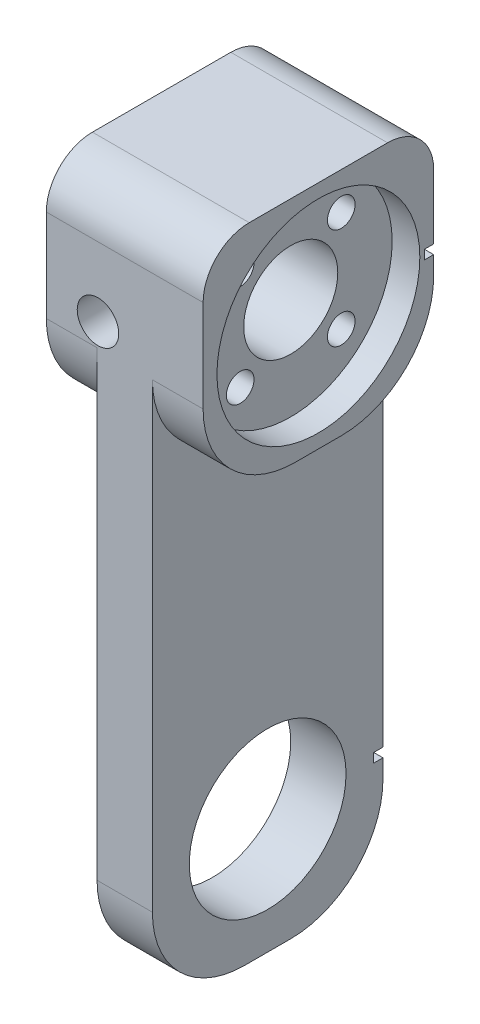
from build123d import *

# Parameters (mm, degrees)
CROQUIS1_W              = 25
CROQUIS1_H              = 25
SALIENTE_EXTRUIR1_DEPTH = 200
REDONDEO1_R             = 10
REDONDEO2_R             = 10
REDONDEO3_R             = 5
REDONDEO4_R             = 5
CROQUIS2_R              = 11
CROQUIS2_R_2            = 8.5
CORTAR_EXTRUIR1_DEPTH   = 6
CROQUIS3_R              = 8.5
CORTAR_EXTRUIR2_DEPTH   = 6
CROQUIS9_R              = 5.1
CROQUIS9_R_2            = 6
CORTAR_EXTRUIR6_DEPTH   = 30
CROQUIS13_W             = 1
CROQUIS13_H             = 5
CORTAR_EXTRUIR8_DEPTH   = 1
SALIENTE_EXTRUIR3_START = 3
CROQUIS14_R             = 11
CROQUIS14_R_2           = 5.1
SALIENTE_EXTRUIR3_DEPTH = 3
CROQUIS15_R             = 1.5
CORTAR_EXTRUIR9_DEPTH   = 16
CORTAR_EXTRUIR10_DEPTH  = 11
CORTAR_EXTRUIR12_REACH  = 205.101
CROQUIS18_W             = 1
CROQUIS18_H             = 1
CROQUIS20_W             = 17
CROQUIS20_H             = 100
CORTAR_EXTRUIR14_DEPTH  = 10
CROQUIS12_R             = 2.25
CORTAR_EXTRUIR7_DEPTH   = 204.100960116
CROQUIS21_W             = 58.914779702
CROQUIS21_H             = 35.760408196
CORTAR_EXTRUIR15_DEPTH  = 125
CROQUIS22_W             = 33.286593493
CROQUIS22_H             = 72.977677401
CORTAR_EXTRUIR16_DEPTH  = 8
REDONDEO5_R             = 10
CROQUIS24_R             = 8.5
CORTAR_EXTRUIR18_DEPTH  = 27
CROQUIS25_W             = 26.132042823
CROQUIS25_H             = 80
CORTAR_EXTRUIR19_DEPTH  = 5.5
REDONDEO6_R             = 10
REDONDEO7_R             = 10
CROQUIS27_W             = 27.934503923
CROQUIS27_H             = 80
CORTAR_EXTRUIR21_DEPTH  = 13.5
REDONDEO8_R             = 10
REDONDEO9_R             = 10


with BuildPart() as part:
    # Croquis1 → Saliente-Extruir1 (new body)
    with BuildSketch(Plane(origin=(0, 0, 0), x_dir=(1, 0, 0), z_dir=(0, 1, 0))):
        with Locations((12.5, 12.5)):
            Rectangle(CROQUIS1_W, CROQUIS1_H)
    extrude(amount=SALIENTE_EXTRUIR1_DEPTH)

    # Redondeo1
    redondeo1_edges = [part.edges().sort_by_distance(p)[0] for p in [
        (12.5, 0, -25),
    ]]
    fillet(redondeo1_edges, radius=REDONDEO1_R)

    # Redondeo2
    redondeo2_edges = [part.edges().sort_by_distance(p)[0] for p in [
        (12.5, 0, 0),
    ]]
    fillet(redondeo2_edges, radius=REDONDEO2_R)

    # Redondeo3
    redondeo3_edges = [part.edges().sort_by_distance(p)[0] for p in [
        (12.5, 200, 0),
    ]]
    fillet(redondeo3_edges, radius=REDONDEO3_R)

    # Redondeo4
    redondeo4_edges = [part.edges().sort_by_distance(p)[0] for p in [
        (12.5, 200, -25),
    ]]
    fillet(redondeo4_edges, radius=REDONDEO4_R)

    # Croquis2 → Cortar-Extruir1 (cut)
    with BuildSketch(Plane(origin=(25, 0, 0), x_dir=(0, 0, -1), z_dir=(1, 0, 0))):
        with Locations((12.5, 187.5)):
            Circle(CROQUIS2_R)
        with Locations(Location((12.5, 137.5, 0), (0, 0, 180))):
            Circle(CROQUIS2_R_2)
    extrude(amount=-CORTAR_EXTRUIR1_DEPTH, mode=Mode.SUBTRACT)

    # Croquis3 → Cortar-Extruir2 (cut)
    with BuildSketch(Plane.ZY):
        with Locations((-12.5, 12.5)):
            Circle(CROQUIS3_R)
        with Locations(Location((-12.5, 187.5, 0), (0, 0, 180))):
            Circle(CROQUIS3_R)
    extrude(amount=-CORTAR_EXTRUIR2_DEPTH, mode=Mode.SUBTRACT)

    # Croquis9 → Cortar-Extruir6 (cut)
    with BuildSketch(Plane(origin=(19, 0, 0), x_dir=(0, 0, -1), z_dir=(1, 0, 0))):
        with Locations((12.5, 187.5)):
            Circle(CROQUIS9_R)
        with Locations((12.5, 137.5)):
            Circle(CROQUIS9_R_2)
    extrude(amount=-CORTAR_EXTRUIR6_DEPTH, mode=Mode.SUBTRACT)

    # Croquis13 → Cortar-Extruir8 (cut)
    with BuildSketch(Plane(origin=(0, 0, -25), x_dir=(-1, 0, 0), z_dir=(0, 0, -1))):
        with Locations((-12.5, 187.04733642)):
            Rectangle(CROQUIS13_W, CROQUIS13_H)
    extrude(amount=-CORTAR_EXTRUIR8_DEPTH, mode=Mode.SUBTRACT)

    # Croquis14 → Saliente-Extruir3 (add)
    with BuildSketch(Plane(origin=(19, 0, 0), x_dir=(0, 0, -1), z_dir=(1, 0, 0)).offset(SALIENTE_EXTRUIR3_START)):
        with Locations((12.5, 187.5)):
            Circle(CROQUIS14_R)
        with Locations((12.5, 187.5)):
            Circle(CROQUIS14_R_2, mode=Mode.SUBTRACT)
    extrude(amount=-SALIENTE_EXTRUIR3_DEPTH)

    # Croquis15 → Cortar-Extruir9 (cut)
    with BuildSketch(Plane(origin=(22, 0, 0), x_dir=(0, 0, -1), z_dir=(1, 0, 0))):
        with Locations((17.980077554, 182.019922446)):
            Circle(CROQUIS15_R)
        with Locations((7.019922446, 182.019922446)):
            Circle(CROQUIS15_R)
        with Locations((7.019922446, 192.980077554)):
            Circle(CROQUIS15_R)
        with Locations((17.980077554, 192.980077554)):
            Circle(CROQUIS15_R)
    extrude(amount=-CORTAR_EXTRUIR9_DEPTH, mode=Mode.SUBTRACT)

    # Croquis16 → Cortar-Extruir10 (cut)
    with BuildSketch(Plane.ZY):
        Polygon((-14.829996635, 192.251844396), (-15.774368679, 195.344011075), (-18.924449599, 196.072244234), (-21.130158474, 193.708310713), (-20.185786429, 190.616144033), (-17.035705509, 189.887910875), align=None)
        Polygon((-17.251844396, 185.170003365), (-20.344011075, 184.225631321), (-21.072244234, 181.075550401), (-18.708310713, 178.869841526), (-15.616144033, 179.814213571), (-14.887910875, 182.964294491), align=None)
        Polygon((-7.748155604, 189.829996635), (-4.655988925, 190.774368679), (-3.927755766, 193.924449599), (-6.291689287, 196.130158474), (-9.383855967, 195.185786429), (-10.112089125, 192.035705509), align=None)
        Polygon((-10.170003365, 182.748155604), (-9.225631321, 179.655988925), (-6.075550401, 178.927755766), (-3.869841526, 181.291689287), (-4.814213571, 184.383855967), (-7.964294491, 185.112089125), align=None)
    extrude(amount=-CORTAR_EXTRUIR10_DEPTH, mode=Mode.SUBTRACT)

    # Cortar-Extruir12: up to this face of the body (flat: up to its plane)
    cortar_extruir12_end = Plane(part.part.faces().sort_by_distance((0, 98.930151157, -12.5))[0])
    # Croquis18 → Cortar-Extruir12 (cut, up to the picked face)
    with BuildSketch(Plane(origin=(25, 0, 0), x_dir=(0, 0, -1), z_dir=(1, 0, 0)), mode=Mode.PRIVATE) as cortar_extruir12_sk1:
        with Locations((24.5, 187.5)):
            Rectangle(CROQUIS18_W, CROQUIS18_H)
    cortar_extruir12_tool1 = split(extrude(cortar_extruir12_sk1.sketch, amount=-CORTAR_EXTRUIR12_REACH, mode=Mode.PRIVATE), bisect_by=cortar_extruir12_end, keep=Keep.BOTH, mode=Mode.PRIVATE)
    # Croquis18 → Cortar-Extruir12 (cut, up to the picked face)
    with BuildSketch(Plane(origin=(25, 0, 0), x_dir=(0, 0, -1), z_dir=(1, 0, 0)), mode=Mode.PRIVATE) as cortar_extruir12_sk2:
        with Locations((24.5, 137.5)):
            Rectangle(CROQUIS18_W, CROQUIS18_H)
    cortar_extruir12_tool2 = split(extrude(cortar_extruir12_sk2.sketch, amount=-CORTAR_EXTRUIR12_REACH, mode=Mode.PRIVATE), bisect_by=cortar_extruir12_end, keep=Keep.BOTH, mode=Mode.PRIVATE)
    add(cortar_extruir12_tool1.solids().sort_by(Axis((25, 187.5, -24.5), (-1, 0, 0)))[0], mode=Mode.SUBTRACT)
    add(cortar_extruir12_tool2.solids().sort_by(Axis((25, 137.5, -24.5), (-1, 0, 0)))[0], mode=Mode.SUBTRACT)

    # Croquis20 → Cortar-Extruir14 (cut)
    with BuildSketch(Plane.ZY):
        with Locations((-12.5, 75)):
            Rectangle(CROQUIS20_W, CROQUIS20_H)
    extrude(amount=-CORTAR_EXTRUIR14_DEPTH, mode=Mode.SUBTRACT)

    # Croquis12 → Cortar-Extruir7 (cut, through all)
    with BuildSketch(Plane(origin=(0, 0, -25), x_dir=(-1, 0, 0), z_dir=(0, 0, -1))):
        with Locations((-13.6, 187.5)):
            Circle(CROQUIS12_R)
    extrude(amount=-CORTAR_EXTRUIR7_DEPTH, mode=Mode.SUBTRACT)

    # Croquis21 → Cortar-Extruir15 (cut)
    with BuildSketch(Plane.XZ):
        with Locations((8.512503063, -10.548361389)):
            Rectangle(CROQUIS21_W, CROQUIS21_H)
    extrude(amount=-CORTAR_EXTRUIR15_DEPTH, mode=Mode.SUBTRACT)

    # Croquis22 → Cortar-Extruir16 (cut)
    with BuildSketch(Plane.ZY):
        with Locations((-13.640786543, 171.307251967)):
            Rectangle(CROQUIS22_W, CROQUIS22_H)
    extrude(amount=-CORTAR_EXTRUIR16_DEPTH, mode=Mode.SUBTRACT)

    # Redondeo5
    redondeo5_edges = [part.edges().sort_by_distance(p)[0] for p in [
        (12.5, 125, -25),
        (12.5, 125, 0),
    ]]
    fillet(redondeo5_edges, radius=REDONDEO5_R)

    # Croquis24 → Cortar-Extruir18 (cut)
    with BuildSketch(Plane(origin=(19, 0, 0), x_dir=(0, 0, -1), z_dir=(1, 0, 0))):
        with Locations(Location((12.5, 137.5, 0), (0, 0, 341.610158782))):
            Circle(CROQUIS24_R)
    extrude(amount=-CORTAR_EXTRUIR18_DEPTH, mode=Mode.SUBTRACT)

    # Croquis25 → Cortar-Extruir19 (cut)
    with BuildSketch(Plane(origin=(25, 0, 0), x_dir=(0, 0, -1), z_dir=(1, 0, 0))):
        with Locations((13.066021412, 135)):
            Rectangle(CROQUIS25_W, CROQUIS25_H)
    extrude(amount=-CORTAR_EXTRUIR19_DEPTH, mode=Mode.SUBTRACT)

    # Redondeo6
    redondeo6_edges = [part.edges().sort_by_distance(p)[0] for p in [
        (22.25, 175, -25),
    ]]
    fillet(redondeo6_edges, radius=REDONDEO6_R)

    # Redondeo7
    redondeo7_edges = [part.edges().sort_by_distance(p)[0] for p in [
        (22.25, 175, 0),
    ]]
    fillet(redondeo7_edges, radius=REDONDEO7_R)

    # Croquis27 → Cortar-Extruir21 (cut)
    with BuildSketch(Plane.ZY):
        with Locations((-13.967251962, 135)):
            Rectangle(CROQUIS27_W, CROQUIS27_H)
    extrude(amount=-CORTAR_EXTRUIR21_DEPTH, mode=Mode.SUBTRACT)

    # Redondeo8
    # the kernel refuses this fillet: 10 mm, written as the material it takes off along each edge
    with BuildSketch(Plane(origin=(38.5, 175, -25), x_dir=(0, 0, 1), z_dir=(-1, 0, 0))) as redondeo8_piece_1_section:
        with BuildLine():
            CenterArc((REDONDEO8_R, REDONDEO8_R), REDONDEO8_R, 180, 90)
            Line((0, REDONDEO8_R), (0, 0))
            Line((0, 0), (REDONDEO8_R, 0))
        make_face()
    redondeo8_piece_1 = extrude(amount=55.5, mode=Mode.PRIVATE)
    redondeo8_piece_1 = split(redondeo8_piece_1, bisect_by=Plane(origin=(19.5, 177.263951143, -22.736048857), z_dir=(1, 0, 0)), keep=Keep.TOP, mode=Mode.PRIVATE)
    add(redondeo8_piece_1, mode=Mode.SUBTRACT)
    with BuildSketch(Plane(origin=(13.5, 175, -25), x_dir=(0, 0, 1), z_dir=(-1, 0, 0))) as redondeo8_piece_2:
        with BuildLine():
            CenterArc((REDONDEO8_R, REDONDEO8_R), REDONDEO8_R, 180, 90)
            Line((0, REDONDEO8_R), (0, 0))
            Line((0, 0), (REDONDEO8_R, 0))
        make_face()
    extrude(amount=30.5, mode=Mode.SUBTRACT)

    # Redondeo9
    redondeo9_edges = [part.edges().sort_by_distance(p)[0] for p in [
        (10.75, 175, 0),
    ]]
    fillet(redondeo9_edges, radius=REDONDEO9_R)


solid = part.part
